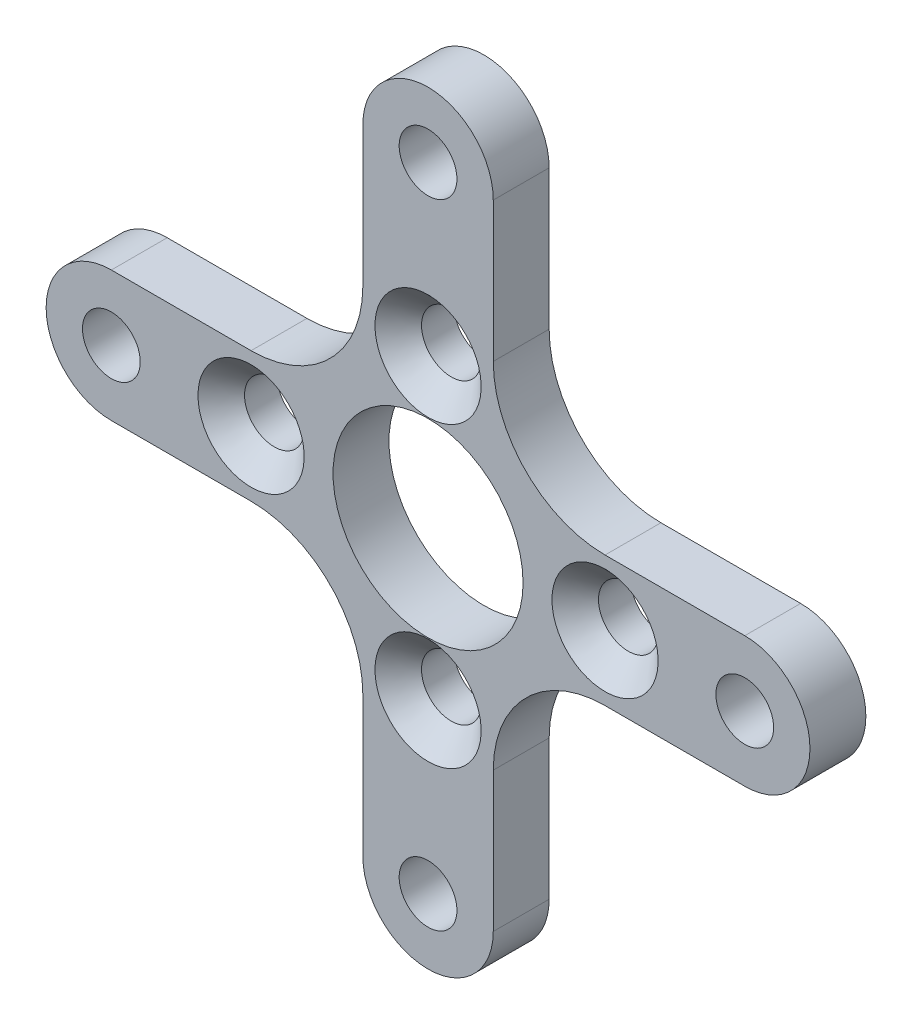
from build123d import *

# Parameters (mm, degrees)
SKETCH1_R           = 5.1
SKETCH1_R_2         = 1.6
SKETCH1_R_3         = 1.55
BOSS_EXTRUDE1_DEPTH = 3
CHAMFER1_SIZE       = 1.25


with BuildPart() as part:
    # Sketch1 → Boss-Extrude1 (new body)
    with BuildSketch(Plane(origin=(0, 0, 0), x_dir=(0, 1, 0), z_dir=(0, 0, 1))):
        with BuildLine():
            Line((3.5, 17), (3.5, 9.5))
            ThreePointArc((3.5, 9.5), (5.257359313, 5.257359313), (9.5, 3.5))
            Line((9.5, 3.5), (17, 3.5))
            ThreePointArc((17, 3.5), (20.5, 0), (17, -3.5))
            Line((17, -3.5), (9.5, -3.5))
            ThreePointArc((9.5, -3.5), (5.257359313, -5.257359313), (3.5, -9.5))
            Line((3.5, -9.5), (3.5, -17))
            ThreePointArc((3.5, -17), (0, -20.5), (-3.5, -17))
            Line((-3.5, -17), (-3.5, -9.5))
            ThreePointArc((-3.5, -9.5), (-5.257359313, -5.257359313), (-9.5, -3.5))
            Line((-9.5, -3.5), (-17, -3.5))
            ThreePointArc((-17, -3.5), (-20.5, 0), (-17, 3.5))
            Line((-17, 3.5), (-9.5, 3.5))
            ThreePointArc((-9.5, 3.5), (-5.257359313, 5.257359313), (-3.5, 9.5))
            Line((-3.5, 9.5), (-3.5, 17))
            ThreePointArc((-3.5, 17), (0, 20.5), (3.5, 17))
        make_face()
        Circle(SKETCH1_R, mode=Mode.SUBTRACT)
        with Locations((0, 9.5)):
            Circle(SKETCH1_R_2, mode=Mode.SUBTRACT)
        with Locations((8, 0)):
            Circle(SKETCH1_R_2, mode=Mode.SUBTRACT)
        with Locations((-8, 0)):
            Circle(SKETCH1_R_2, mode=Mode.SUBTRACT)
        with Locations((0, -9.5)):
            Circle(SKETCH1_R_2, mode=Mode.SUBTRACT)
        with Locations((0, 17)):
            Circle(SKETCH1_R_3, mode=Mode.SUBTRACT)
        with Locations((17, 0)):
            Circle(SKETCH1_R_3, mode=Mode.SUBTRACT)
        with Locations((-17, 0)):
            Circle(SKETCH1_R_3, mode=Mode.SUBTRACT)
        with Locations((0, -17)):
            Circle(SKETCH1_R_3, mode=Mode.SUBTRACT)
    extrude(amount=BOSS_EXTRUDE1_DEPTH)

    # Chamfer1
    chamfer1_edges = [part.edges().sort_by_distance(p)[0] for p in [
        (9.5, -1.6, 3),
        (0, 6.4, 3),
        (-9.5, -1.6, 3),
        (0, -9.6, 3),
    ]]
    chamfer(chamfer1_edges, length=CHAMFER1_SIZE)


solid = part.part
